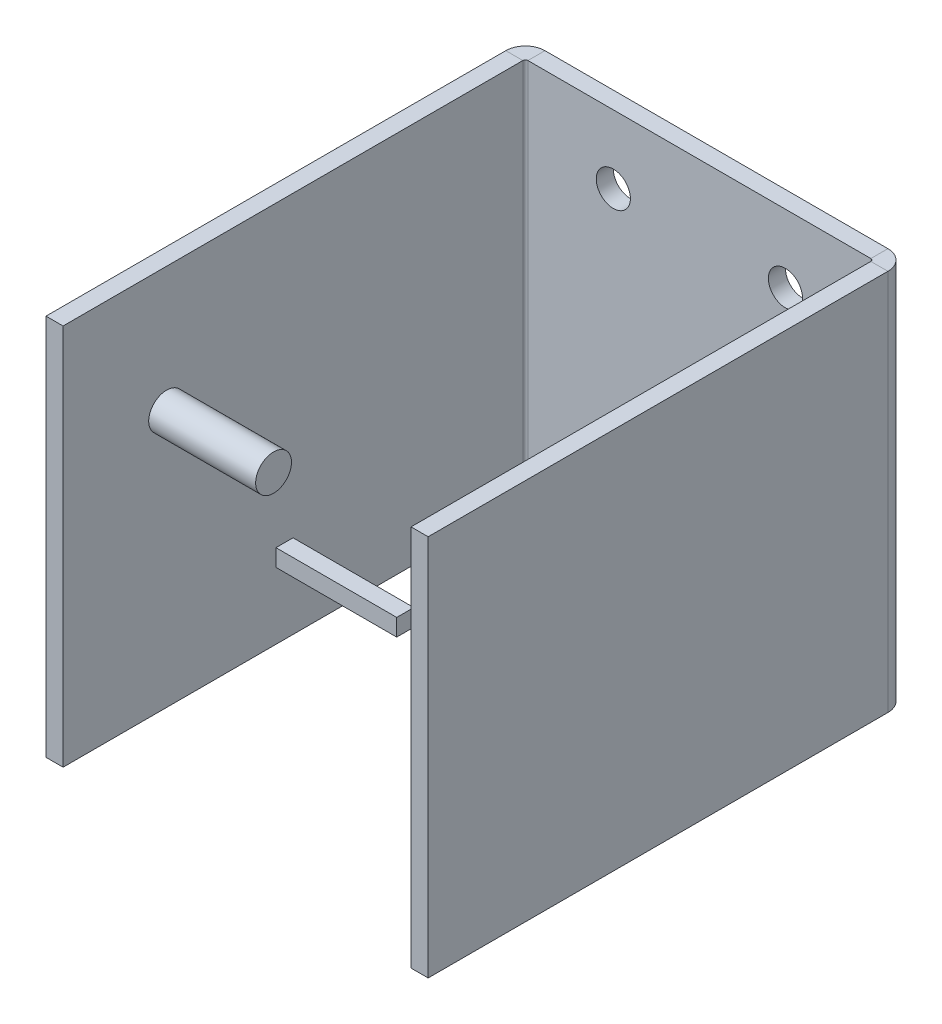
from build123d import *

# Parameters (mm, degrees)
SKETCH13_W                   = 111.84
SKETCH13_H                   = 111.84
BASE_FLANGE2_DEPTH           = 5
EDGE_FLANGE1_STRIP_W         = 21.4732
EDGE_FLANGE1_STRIP_H         = 5
EDGE_FLANGE1_STRIP_CUT_DEPTH = 111.84
EDGE_FLANGE1_DEPTH           = 111.84
EDGE_FLANGE2_STRIP_W         = 21.4732
EDGE_FLANGE2_STRIP_H         = 5
EDGE_FLANGE2_STRIP_CUT_DEPTH = 111.84
EDGE_FLANGE2_DEPTH           = 111.84
SKETCH25_R                   = 5
CUT_EXTRUDE1_DEPTH           = 209.139184211
SKETCH27_W                   = 5
SKETCH27_H                   = 5
BOSS_EXTRUDE3_DEPTH          = 35.342
SKETCH28_W                   = 5
SKETCH28_H                   = 5
BOSS_EXTRUDE1_DEPTH          = 36.5
BOSS_EXTRUDE2_DEPTH          = 5
SKETCH40_R                   = 5.2455
BOSS_EXTRUDE7_DEPTH          = 31.3


# Sheet-metal steps are written as plain solids
with BuildPart() as part:
    # Sketch13 → Base-Flange2 (new body)
    with BuildSketch(Plane.XY):
        with Locations((55.92, 55.92)):
            Rectangle(SKETCH13_W, SKETCH13_H)
    extrude(amount=-BASE_FLANGE2_DEPTH)

    # Edge-Flange1 strip (across the edge) → Edge-Flange1 strip cut (cut)
    with BuildSketch(Plane.XZ.offset(-111.84)):
        with Locations((-5, -2.5)):
            Rectangle(EDGE_FLANGE1_STRIP_W, EDGE_FLANGE1_STRIP_H)
    extrude(amount=EDGE_FLANGE1_STRIP_CUT_DEPTH, mode=Mode.SUBTRACT)

    # Edge-Flange1 section (across the edge) → Edge-Flange1 (add)
    with BuildSketch(Plane.XZ.offset(-111.84)):
        with BuildLine():
            Line((0, 0.7366), (0, 135.298))
            Line((0, 135.298), (5, 135.298))
            Line((5, 135.298), (5, 0.7366))
            ThreePointArc((5, 0.7366), (5.215745145, 0.215745145), (5.7366, 0))
            Line((5.7366, 0), (5.7366, -5))
            ThreePointArc((5.7366, -5), (1.680211239, -3.319788761), (0, 0.7366))
        make_face()
    extrude(amount=EDGE_FLANGE1_DEPTH)

    # Edge-Flange2 strip (across the edge) → Edge-Flange2 strip cut (cut)
    with BuildSketch(Plane(origin=(111.84, 0, 0), x_dir=(-1, 0, 0), z_dir=(0, 1, 0))):
        with Locations((-5, -2.5)):
            Rectangle(EDGE_FLANGE2_STRIP_W, EDGE_FLANGE2_STRIP_H)
    extrude(amount=EDGE_FLANGE2_STRIP_CUT_DEPTH, mode=Mode.SUBTRACT)

    # Edge-Flange2 section (across the edge) → Edge-Flange2 (add)
    with BuildSketch(Plane(origin=(111.84, 0, 0), x_dir=(-1, 0, 0), z_dir=(0, 1, 0))):
        with BuildLine():
            Line((0, 0.7366), (0, 135.298))
            Line((0, 135.298), (5, 135.298))
            Line((5, 135.298), (5, 0.7366))
            ThreePointArc((5, 0.7366), (5.215745145, 0.215745145), (5.7366, 0))
            Line((5.7366, 0), (5.7366, -5))
            ThreePointArc((5.7366, -5), (1.680211239, -3.319788761), (0, 0.7366))
        make_face()
    extrude(amount=EDGE_FLANGE2_DEPTH)

    # Sketch25 → Cut-Extrude1 (cut, through all)
    with BuildSketch(Plane.XY):
        with Locations((30.7366, 91.84)):
            Circle(SKETCH25_R)
        with Locations(Location((81.1034, 91.84, 0), (0, 0, 180))):
            Circle(SKETCH25_R)
    extrude(amount=-CUT_EXTRUDE1_DEPTH, mode=Mode.SUBTRACT)

    # Sketch27 → Boss-Extrude3 (add)
    with BuildSketch(Plane(origin=(5, 0, 0), x_dir=(0, 0, -1), z_dir=(1, 0, 0))):
        with Locations((-70.5, 22)):
            Rectangle(SKETCH27_W, SKETCH27_H)
    extrude(amount=BOSS_EXTRUDE3_DEPTH)

    # Sketch28 → Boss-Extrude1 (add)
    with BuildSketch(Plane.ZY.offset(-106.84)):
        with Locations((70.5, 22)):
            Rectangle(SKETCH28_W, SKETCH28_H)
    extrude(amount=BOSS_EXTRUDE1_DEPTH)

    # Sketch29 → Boss-Extrude2 (add)
    with BuildSketch(Plane(origin=(0, 24.5, 0), x_dir=(1, 0, 0), z_dir=(0, 1, 0))):
        with BuildLine():
            Line((45.436988134, -73), (47.484648624, -73))
            ThreePointArc((47.484648624, -73), (57.888494067, -59.8), (68.29233951, -73))
            Line((68.29233951, -73), (70.34, -73))
            ThreePointArc((70.34, -73), (57.888494067, -57.8), (45.436988134, -73))
        make_face()
    extrude(amount=-BOSS_EXTRUDE2_DEPTH)

    # Sketch40 → Boss-Extrude7 (add)
    with BuildSketch(Plane(origin=(5, 0, 0), x_dir=(0, 0, -1), z_dir=(1, 0, 0))):
        with Locations((-105, 75.186)):
            Circle(SKETCH40_R)
    extrude(amount=BOSS_EXTRUDE7_DEPTH)


solid = part.part
